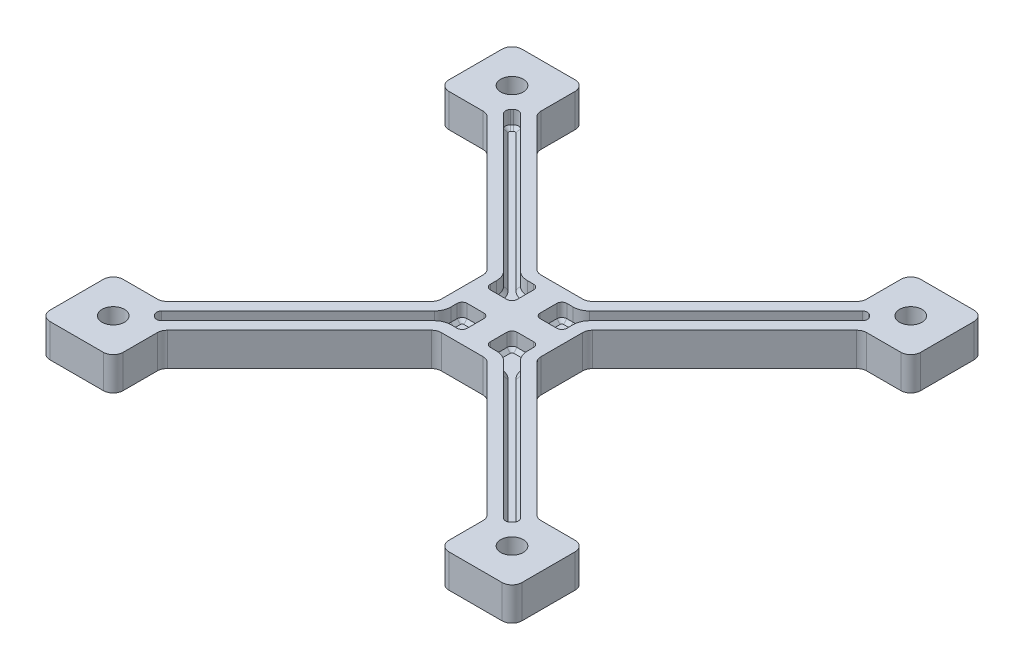
from build123d import *

# Parameters (mm, degrees)
BOSS_EXTRUDE1_DEPTH     = 10
F_1_4_CLEARANCE_HOLE1_D = 6.7564
CUT_EXTRUDE1_DEPTH      = 5
CHAMFER1_SIZE           = 1
FILLET1_R               = 3


with BuildPart() as part:
    # Sketch1 → Boss-Extrude1 (new body)
    with BuildSketch(Plane(origin=(0, 0, 0), x_dir=(1, 0, 0), z_dir=(0, 1, 0))):
        Polygon((60, 82.5), (60, 67.5), (18.5, 26), (4, 26), (4, 4), (26, 4), (26, 18.5), (67.5, 60), (82.5, 60), (124, 18.5), (124, 4), (146, 4), (146, 26), (131.5, 26), (90, 67.5), (90, 82.5), (131.5, 124), (146, 124), (146, 146), (124, 146), (124, 131.5), (82.5, 90), (67.5, 90), (26, 131.5), (26, 146), (4, 146), (4, 124), (18.5, 124), align=None)
    extrude(amount=-BOSS_EXTRUDE1_DEPTH)

    # 1/4 Clearance Hole1 (through all)
    with Locations(Plane(origin=(0, 0, 0), x_dir=(1, 0, 0), z_dir=(0, 1, 0))):
        with Locations((15, 15), (15, 135), (135, 135), (135, 15)):
            Hole(F_1_4_CLEARANCE_HOLE1_D / 2)

    # Sketch4 → Cut-Extrude1 (cut)
    with BuildSketch(Plane(origin=(0, 0, 0), x_dir=(1, 0, 0), z_dir=(0, 1, 0))):
        with BuildLine():
            Line((86.5, 70), (86.5, 68.121320344))
            ThreePointArc((86.5, 68.121320344), (86.880602337, 66.207903182), (87.964466094, 64.585786438))
            Line((87.964466094, 64.585786438), (128.98959236, 23.560660172))
            ThreePointArc((128.98959236, 23.560660172), (129.428932188, 22.5), (128.98959236, 21.439339828))
            Line((128.98959236, 21.439339828), (128.560660172, 21.01040764))
            ThreePointArc((128.560660172, 21.01040764), (127.5, 20.571067812), (126.439339828, 21.01040764))
            Line((126.439339828, 21.01040764), (85.414213562, 62.035533906))
            ThreePointArc((85.414213562, 62.035533906), (83.792096818, 63.119397663), (81.878679656, 63.5))
            Line((81.878679656, 63.5), (80, 63.5))
            ThreePointArc((80, 63.5), (78.939339828, 63.939339828), (78.5, 65))
            Line((78.5, 65), (78.5, 70))
            ThreePointArc((78.5, 70), (78.939339828, 71.060660172), (80, 71.5))
            Line((80, 71.5), (85, 71.5))
            ThreePointArc((85, 71.5), (86.060660172, 71.060660172), (86.5, 70))
        make_face()
        with BuildLine():
            Line((62.035533906, 64.585786438), (21.01040764, 23.560660172))
            ThreePointArc((21.01040764, 23.560660172), (20.571067812, 22.5), (21.01040764, 21.439339828))
            Line((21.01040764, 21.439339828), (21.439339828, 21.01040764))
            ThreePointArc((21.439339828, 21.01040764), (22.5, 20.571067812), (23.560660172, 21.01040764))
            Line((23.560660172, 21.01040764), (64.585786438, 62.035533906))
            ThreePointArc((64.585786438, 62.035533906), (66.207903182, 63.119397663), (68.121320344, 63.5))
            Line((68.121320344, 63.5), (70, 63.5))
            ThreePointArc((70, 63.5), (71.060660172, 63.939339828), (71.5, 65))
            Line((71.5, 65), (71.5, 70))
            ThreePointArc((71.5, 70), (71.060660172, 71.060660172), (70, 71.5))
            Line((70, 71.5), (65, 71.5))
            ThreePointArc((65, 71.5), (63.939339828, 71.060660172), (63.5, 70))
            Line((63.5, 70), (63.5, 68.121320344))
            ThreePointArc((63.5, 68.121320344), (63.119397663, 66.207903182), (62.035533906, 64.585786438))
        make_face()
        with BuildLine():
            Line((63.5, 80), (63.5, 81.878679656))
            ThreePointArc((63.5, 81.878679656), (63.119397663, 83.792096818), (62.035533906, 85.414213562))
            Line((62.035533906, 85.414213562), (21.01040764, 126.439339828))
            ThreePointArc((21.01040764, 126.439339828), (20.571067812, 127.5), (21.01040764, 128.560660172))
            Line((21.01040764, 128.560660172), (21.439339828, 128.98959236))
            ThreePointArc((21.439339828, 128.98959236), (22.5, 129.428932188), (23.560660172, 128.98959236))
            Line((23.560660172, 128.98959236), (64.585786438, 87.964466094))
            ThreePointArc((64.585786438, 87.964466094), (66.207903182, 86.880602337), (68.121320344, 86.5))
            Line((68.121320344, 86.5), (70, 86.5))
            ThreePointArc((70, 86.5), (71.060660172, 86.060660172), (71.5, 85))
            Line((71.5, 85), (71.5, 80))
            ThreePointArc((71.5, 80), (71.060660172, 78.939339828), (70, 78.5))
            Line((70, 78.5), (65, 78.5))
            ThreePointArc((65, 78.5), (63.939339828, 78.939339828), (63.5, 80))
        make_face()
        with BuildLine():
            Line((128.560660172, 128.98959236), (128.98959236, 128.560660172))
            ThreePointArc((128.98959236, 128.560660172), (129.428932188, 127.5), (128.98959236, 126.439339828))
            Line((128.98959236, 126.439339828), (87.964466094, 85.414213562))
            ThreePointArc((87.964466094, 85.414213562), (86.880602337, 83.792096818), (86.5, 81.878679656))
            Line((86.5, 81.878679656), (86.5, 80))
            ThreePointArc((86.5, 80), (86.060660172, 78.939339828), (85, 78.5))
            Line((85, 78.5), (80, 78.5))
            ThreePointArc((80, 78.5), (78.939339828, 78.939339828), (78.5, 80))
            Line((78.5, 80), (78.5, 85))
            ThreePointArc((78.5, 85), (78.939339828, 86.060660172), (80, 86.5))
            Line((80, 86.5), (81.878679656, 86.5))
            ThreePointArc((81.878679656, 86.5), (83.792096818, 86.880602337), (85.414213562, 87.964466094))
            Line((85.414213562, 87.964466094), (126.439339828, 128.98959236))
            ThreePointArc((126.439339828, 128.98959236), (127.5, 129.428932188), (128.560660172, 128.98959236))
        make_face()
    extrude(amount=-CUT_EXTRUDE1_DEPTH, mode=Mode.SUBTRACT)

    # Chamfer1
    chamfer1_edges = [part.edges().sort_by_distance(p)[0] for p in [
        (108.477029227, -5, -44.073223305),
        (129.428932188, -5, -22.5),
        (128.775126266, -5, -21.224873734),
        (127.5, -5, -20.571067812),
        (105.926776695, -5, -41.522970773),
        (83.792096818, -5, -63.119397663),
        (80.939339828, -5, -63.5),
        (78.939339828, -5, -63.939339828),
        (78.5, -5, -67.5),
        (78.939339828, -5, -71.060660172),
        (82.5, -5, -71.5),
        (86.060660172, -5, -71.060660172),
        (86.5, -5, -69.060660172),
        (86.880602337, -5, -66.207903182),
        (86.5, -5, -80.939339828),
        (86.060660172, -5, -78.939339828),
        (82.5, -5, -78.5),
        (78.939339828, -5, -78.939339828),
        (78.5, -5, -82.5),
        (78.939339828, -5, -86.060660172),
        (80.939339828, -5, -86.5),
        (83.792096818, -5, -86.880602337),
        (105.926776695, -5, -108.477029227),
        (127.5, -5, -129.428932188),
        (128.775126266, -5, -128.775126266),
        (129.428932188, -5, -127.5),
        (108.477029227, -5, -105.926776695),
        (86.880602337, -5, -83.792096818),
        (41.522970773, -5, -105.926776695),
        (20.571067812, -5, -127.5),
        (21.224873734, -5, -128.775126266),
        (22.5, -5, -129.428932188),
        (44.073223305, -5, -108.477029227),
        (66.207903182, -5, -86.880602337),
        (69.060660172, -5, -86.5),
        (71.060660172, -5, -86.060660172),
        (71.5, -5, -82.5),
        (71.060660172, -5, -78.939339828),
        (67.5, -5, -78.5),
        (63.939339828, -5, -78.939339828),
        (63.5, -5, -80.939339828),
        (63.119397663, -5, -83.792096818),
        (63.5, -5, -69.060660172),
        (63.939339828, -5, -71.060660172),
        (67.5, -5, -71.5),
        (71.060660172, -5, -71.060660172),
        (71.5, -5, -67.5),
        (71.060660172, -5, -63.939339828),
        (69.060660172, -5, -63.5),
        (66.207903182, -5, -63.119397663),
        (44.073223305, -5, -41.522970773),
        (22.5, -5, -20.571067812),
        (21.224873734, -5, -21.224873734),
        (20.571067812, -5, -22.5),
        (41.522970773, -5, -44.073223305),
        (63.119397663, -5, -66.207903182),
        (138.3782, -10, -135),
        (18.3782, -10, -135),
        (18.3782, -10, -15),
        (138.3782, -10, -15),
    ]]
    chamfer(chamfer1_edges, length=CHAMFER1_SIZE)

    # Fillet1
    fillet1_edges = [part.edges().sort_by_distance(p)[0] for p in [
        (67.5, -5, -90),
        (82.5, -5, -90),
        (60, -5, -82.5),
        (60, -5, -67.5),
        (67.5, -5, -60),
        (82.5, -5, -60),
        (90, -5, -67.5),
        (90, -5, -82.5),
        (146, -5, -146),
        (131.5, -5, -124),
        (124, -5, -146),
        (146, -5, -124),
        (124, -5, -131.5),
        (18.5, -5, -124),
        (26, -5, -131.5),
        (26, -5, -146),
        (4, -5, -124),
        (4, -5, -146),
        (4, -5, -26),
        (18.5, -5, -26),
        (4, -5, -4),
        (26, -5, -18.5),
        (26, -5, -4),
        (124, -5, -18.5),
        (131.5, -5, -26),
        (146, -5, -26),
        (124, -5, -4),
        (146, -5, -4),
    ]]
    fillet(fillet1_edges, radius=FILLET1_R)


solid = part.part
